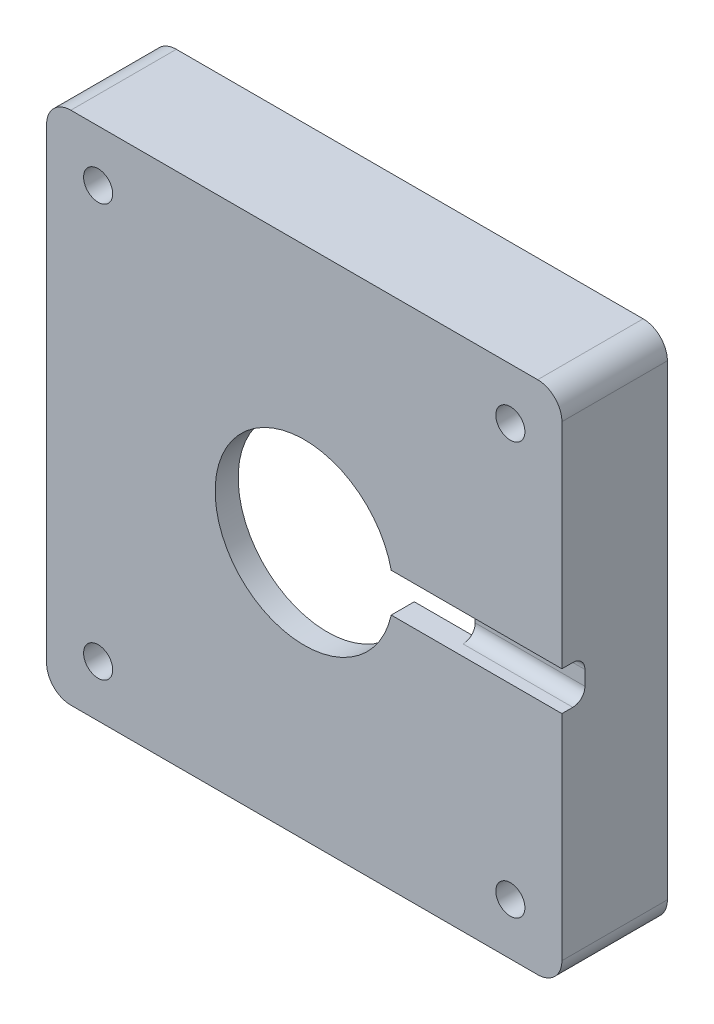
from build123d import *

# Parameters (mm, degrees)
SKETCH1_R           = 1.2
BOSS_EXTRUDE1_DEPTH = 8.7
CUT_EXTRUDE2_DEPTH  = 3
CUT_EXTRUDE3_DEPTH  = 3.8
CUT_EXTRUDE4_DEPTH  = 1.9
SKETCH5_W           = 1
SKETCH5_H           = 1.5
CUT_EXTRUDE5_DEPTH  = 3
FILLET1_R           = 1


with BuildPart() as part:
    # Sketch1 → Boss-Extrude1 (new body)
    with BuildSketch(Plane.XY):
        with BuildLine():
            Line((21.25, -19.25), (21.25, 19.25))
            ThreePointArc((21.25, 19.25), (20.664213562, 20.664213562), (19.25, 21.25))
            Line((19.25, 21.25), (-19.25, 21.25))
            ThreePointArc((-19.25, 21.25), (-20.664213562, 20.664213562), (-21.25, 19.25))
            Line((-21.25, 19.25), (-21.25, -19.25))
            ThreePointArc((-21.25, -19.25), (-20.664213562, -20.664213562), (-19.25, -21.25))
            Line((-19.25, -21.25), (19.25, -21.25))
            ThreePointArc((19.25, -21.25), (20.664213562, -20.664213562), (21.25, -19.25))
        make_face()
        with Locations(Location((-17, -17, 0), (0, 0, 180))):
            Circle(SKETCH1_R, mode=Mode.SUBTRACT)
        with Locations(Location((17, -17, 0), (0, 0, 180))):
            Circle(SKETCH1_R, mode=Mode.SUBTRACT)
        with Locations(Location((17, 17, 0), (0, 0, 180))):
            Circle(SKETCH1_R, mode=Mode.SUBTRACT)
        with Locations(Location((-17, 17, 0), (0, 0, 180))):
            Circle(SKETCH1_R, mode=Mode.SUBTRACT)
    extrude(amount=BOSS_EXTRUDE1_DEPTH)

    # Sketch2 → Cut-Extrude2 (cut)
    with BuildSketch(Plane(origin=(0, 0, 0), x_dir=(-1, 0, 0), z_dir=(0, 0, -1))):
        with BuildLine():
            Line((14.55, -19.25), (-14.55, -19.25))
            Line((-14.55, -19.25), (-14.55, -17))
            ThreePointArc((-14.55, -17), (-15.267588386, -15.267588386), (-17, -14.55))
            Line((-17, -14.55), (-19.25, -14.55))
            Line((-19.25, -14.55), (-19.25, 14.55))
            Line((-19.25, 14.55), (-17, 14.55))
            ThreePointArc((-17, 14.55), (-15.267588386, 15.267588386), (-14.55, 17))
            Line((-14.55, 17), (-14.55, 19.25))
            Line((-14.55, 19.25), (14.55, 19.25))
            Line((14.55, 19.25), (14.55, 17))
            ThreePointArc((14.55, 17), (15.267588386, 15.267588386), (17, 14.55))
            Line((17, 14.55), (19.25, 14.55))
            Line((19.25, 14.55), (19.25, -14.55))
            Line((19.25, -14.55), (17, -14.55))
            ThreePointArc((17, -14.55), (15.267588386, -15.267588386), (14.55, -17))
            Line((14.55, -17), (14.55, -19.25))
        make_face()
    extrude(amount=-CUT_EXTRUDE2_DEPTH, mode=Mode.SUBTRACT)

    # Sketch3 → Cut-Extrude3 (cut)
    with BuildSketch(Plane(origin=(0, 0, 3), x_dir=(-1, 0, 0), z_dir=(0, 0, -1))):
        with BuildLine():
            Line((-12.2, -6), (-12.2, 6))
            ThreePointArc((-12.2, 6), (-10.091168825, 11.091168825), (-5, 13.2))
            Line((-5, 13.2), (5, 13.2))
            ThreePointArc((5, 13.2), (10.091168825, 11.091168825), (12.2, 6))
            Line((12.2, 6), (12.2, -6))
            ThreePointArc((12.2, -6), (10.091168825, -11.091168825), (5, -13.2))
            Line((5, -13.2), (-5, -13.2))
            ThreePointArc((-5, -13.2), (-10.091168825, -11.091168825), (-12.2, -6))
        make_face()
    extrude(amount=-CUT_EXTRUDE3_DEPTH, mode=Mode.SUBTRACT)

    # Sketch4 → Cut-Extrude4 (cut)
    with BuildSketch(Plane.XY.offset(8.7)):
        with BuildLine():
            Line((21.25, 1.6), (7.173736823, 1.6))
            ThreePointArc((7.173736823, 1.6), (-7.35, 0), (7.173736823, -1.6))
            Line((7.173736823, -1.6), (21.25, -1.6))
            Line((21.25, -1.6), (21.25, 1.6))
        make_face()
    extrude(amount=-CUT_EXTRUDE4_DEPTH, mode=Mode.SUBTRACT)

    # Sketch5 → Cut-Extrude5 (cut)
    with BuildSketch(Plane(origin=(0, 0, 0), x_dir=(-1, 0, 0), z_dir=(0, 0, -1))):
        with Locations((-19.75, -10.3)):
            Rectangle(SKETCH5_W, SKETCH5_H)
    extrude(amount=-CUT_EXTRUDE5_DEPTH, mode=Mode.SUBTRACT)

    # Fillet1
    fillet1_edges = [part.edges().sort_by_distance(p)[0] for p in [
        (19.25, -11.05, 1.5),
        (19.25, -9.55, 1.5),
        (16.725, -1.6, 6.8),
        (16.725, 1.6, 6.8),
    ]]
    fillet(fillet1_edges, radius=FILLET1_R - 0.0001)  # a hair under: the kernel refuses the full size


solid = part.part
